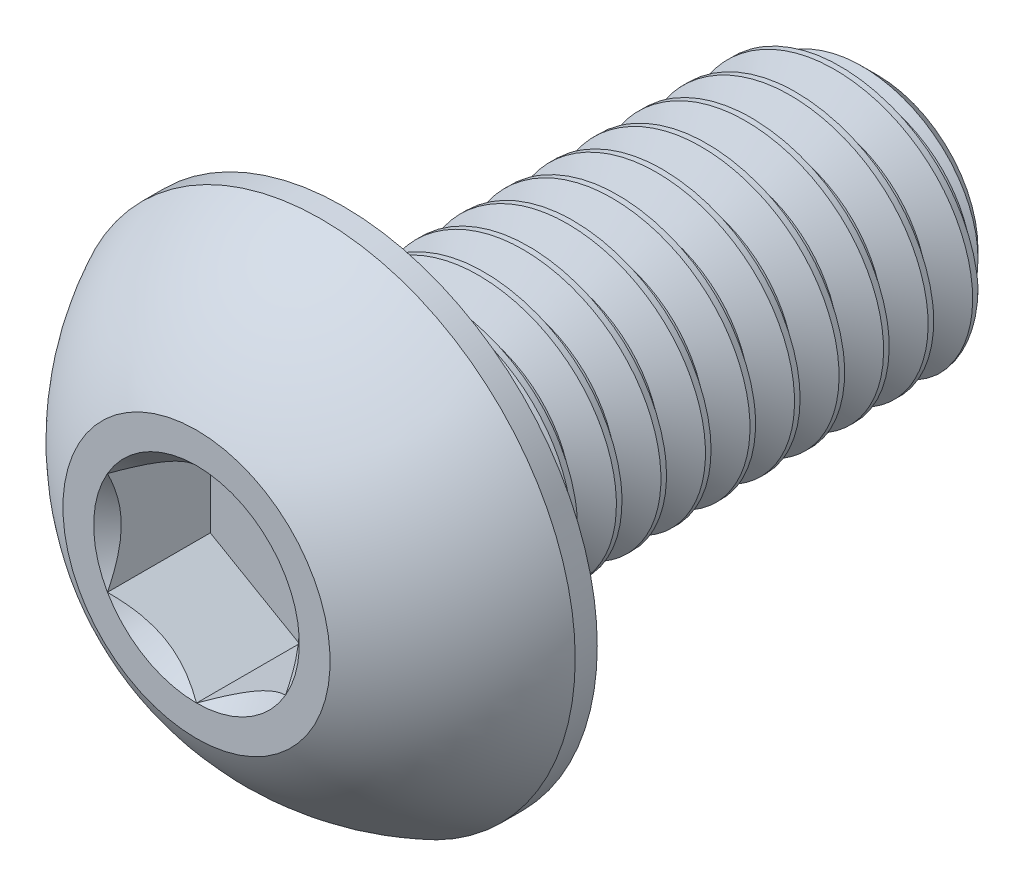
from build123d import *

# Parameters (mm, degrees)
SKETCH1_W              = 6
SKETCH1_H              = 1.5
CUT_EXTRUDE2_DEPTH     = 1.155
SPLIT1_SURFACE_1_BACK  = 12.113
SPLIT1_SURFACE_1_DEPTH = 24.226
SPLIT1_SURFACE_2_BACK  = 12.113
SPLIT1_SURFACE_2_DEPTH = 24.226
CHAMFER1_SIZE          = 0.375
CUT_SWEEP1_PITCH       = 0.5


with BuildPart() as part:
    # Sketch1 → Revolve1 (revolve)
    with BuildSketch(Plane(origin=(0, 0, 0), x_dir=(0, 0, -1), z_dir=(1, 0, 0))):
        with Locations((4.65, 0.75)):
            Rectangle(SKETCH1_W, SKETCH1_H)
    revolve(axis=Axis((0, 0, -7.65), (0, 0, 1)))

    # Sketch7 → Revolve2 (revolve)
    with BuildSketch(Plane(origin=(0, 0, 0), x_dir=(0, 0, -1), z_dir=(1, 0, 0)), mode=Mode.PRIVATE) as revolve2_sk:
        with BuildLine():
            Line((1.4025, 2.85), (1.65, 2.85))
            Line((1.65, 2.85), (1.65, 0))
            Line((1.65, 0), (0, 0))
            Line((0, 0), (0, 1.5))
            ThreePointArc((0, 1.5), (0.59512511, 2.285251969), (1.4025, 2.85))
        make_face()
    revolve(revolve2_sk.sketch.rotate(Axis((0, 0, 0), (0, 0, -1)), 180), axis=Axis((0, 0, 0), (0, 0, -1)))

    # Sketch5 → Cut-Extrude2 (cut)
    with BuildSketch(Plane.XY):
        Polygon((1, -0.577350269), (1, 0.577350269), (0, 1.154700538), (-1, 0.577350269), (-1, -0.577350269), (0, -1.154700538), align=None)
    extrude(amount=-CUT_EXTRUDE2_DEPTH, mode=Mode.SUBTRACT)

    # Cut-Extrude3 cone 1 section (through the dimple's axis) → Cut-Extrude3 (revolve, cut)
    with BuildSketch(Plane(origin=(0, 0, 0), x_dir=(0, -1, 0), z_dir=(1, 0, 0))):
        Polygon((0, 0), (1.154700538, 0), (0, 1.154700538), align=None)
    revolve(axis=Axis((0, 0, 0), (0, 0, -1)), mode=Mode.SUBTRACT)


with BuildPart() as body_2:
    # Split1: the piece behind the surface
    add(part.part)
    # Split1 surface: a surface, the sketch's curves swept straight by 24.226 mm
    with BuildLine(Plane(origin=(0, 0, 0), x_dir=(0, 0, -1), z_dir=(1, 0, 0)).offset(-SPLIT1_SURFACE_1_BACK), mode=Mode.PRIVATE) as split1_surface_1_path:
        Line((1.65, -2.85), (1.65, 2.85))
    split1_surface_1 = Shell.extrude(split1_surface_1_path.wire(), (1 * SPLIT1_SURFACE_1_DEPTH, 0 * SPLIT1_SURFACE_1_DEPTH, 0 * SPLIT1_SURFACE_1_DEPTH))
    split(bisect_by=split1_surface_1, keep=Keep.BOTTOM)

    # Chamfer1
    chamfer1_edges = [body_2.edges().sort_by_distance(p)[0] for p in [
        (0, -1.5, -7.65),
    ]]
    chamfer(chamfer1_edges, length=CHAMFER1_SIZE)

    # Cut-Sweep1: the profile of Sketch2 screwed along a right-hand helix of 13 turns, 6 arcs to a turn; built about Z, then put on its axis
    cut_sweep1_z = Axis((0, 0, 0), (0, 0, 1))
    cut_sweep1_corners = [(1.175240474, 0, -0.1875), (1.175240474, 0, -0.25), (1.527063294, 0, -0.453125), (1.527063294, 0, 0.015625)]
    with BuildLine(mode=Mode.PRIVATE) as cut_sweep1_profile:
        Line(cut_sweep1_corners[0], cut_sweep1_corners[1])
        Line(cut_sweep1_corners[1], cut_sweep1_corners[2])
        Line(cut_sweep1_corners[2], cut_sweep1_corners[3])
        Line(cut_sweep1_corners[3], cut_sweep1_corners[0])
    cut_sweep1_cap = Face(cut_sweep1_profile.wire())
    cut_sweep1_turn_angles = [0, 30, 60, 90, 120, 150, 180, 210, 240, 270, 300, 330, 360]
    cut_sweep1_turn_weights = [1, 0.8660254037844387, 1, 0.8660254037844387, 1, 0.8660254037844387, 1, 0.8660254037844387, 1, 0.8660254037844387, 1, 0.8660254037844387, 1]
    cut_sweep1_turn_rails = [Edge.make_bspline([Vector(p[0], p[1], 0).rotate(cut_sweep1_z, cut_sweep1_turn_angles[k]) / cut_sweep1_turn_weights[k] + Vector(0, 0, p[2] + CUT_SWEEP1_PITCH * cut_sweep1_turn_angles[k] / 360) for k in range(13)], [0, 0, 0, 1, 1, 2, 2, 3, 3, 4, 4, 5, 5, 6, 6, 6], 2, cut_sweep1_turn_weights) for p in cut_sweep1_corners]
    cut_sweep1_turn_sides = [Face.make_surface_from_curves(cut_sweep1_turn_rails[p[0]], cut_sweep1_turn_rails[p[1]]) for p in [(0, 1), (1, 2), (2, 3), (3, 0)]]
    cut_sweep1 = Plane(origin=(0, 0, -7.65), x_dir=(0, 1, 0), z_dir=(0, 0, 1)) * Solid(Shell([*[p.moved(Location((0, 0, CUT_SWEEP1_PITCH * i))) for i in range(13) for p in cut_sweep1_turn_sides], cut_sweep1_cap, cut_sweep1_cap.rotate(cut_sweep1_z, 4680).moved(Location((0, 0, CUT_SWEEP1_PITCH * 4680 / 360)))]))
    add(cut_sweep1, mode=Mode.SUBTRACT)


with BuildPart() as part_1:
    add(part.part)

    # Split1: split by a surface, the side it looks to stays
    # Split1 surface: a surface, the sketch's curves swept straight by 24.226 mm
    with BuildLine(Plane(origin=(0, 0, 0), x_dir=(0, 0, -1), z_dir=(1, 0, 0)).offset(-SPLIT1_SURFACE_2_BACK), mode=Mode.PRIVATE) as split1_surface_2_path:
        Line((1.65, -2.85), (1.65, 2.85))
    split1_surface_2 = Shell.extrude(split1_surface_2_path.wire(), (1 * SPLIT1_SURFACE_2_DEPTH, 0 * SPLIT1_SURFACE_2_DEPTH, 0 * SPLIT1_SURFACE_2_DEPTH))
    split(bisect_by=split1_surface_2, keep=Keep.TOP)

    # Combine1: union body 2
    add(body_2.part)


solid = part_1.part
